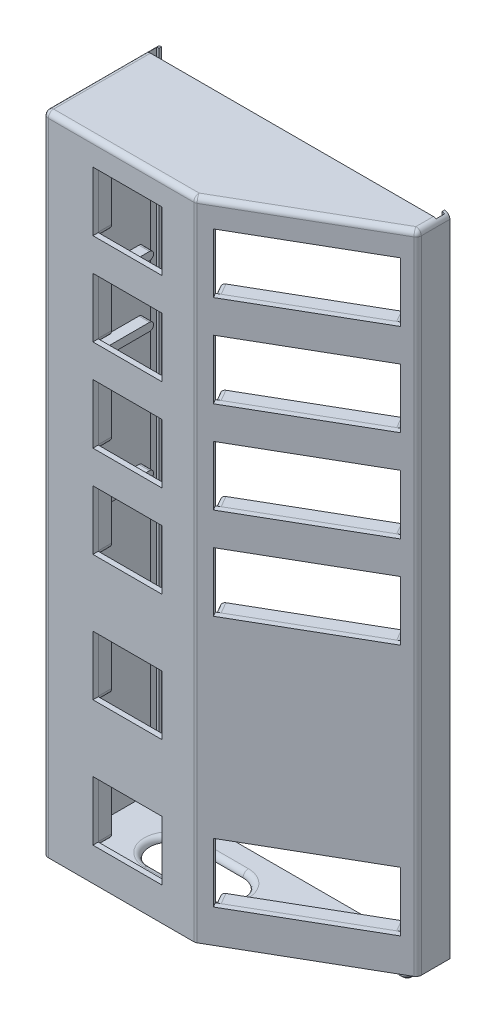
from build123d import *

# Parameters (mm, degrees)
MAIN_BODY_DEPTH           = 241.93
SHELL1_T                  = -2
SINGLE_CUTOUTS_DEPTH      = 252.708123436
SINGLE_CUTOUTS_DEPTH_BACK = 252.708123436
SKETCH3_W                 = 25.87
SKETCH3_H                 = 22.27
DOUBLE_CUTOUTS_DEPTH      = 254.30100721
DOUBLE_CUTOUTS_DEPTH_BACK = 254.30100721
SKETCH4_W                 = 51.25
SKETCH4_H                 = 22.27
SKETCH5_R                 = 2.75
MATING_STUDS_DEPTH        = 5
MATING_STUD_CHAMFER_SIZE  = 1
PASS_THRU_REACH           = 251.009
PCB_MOUNTS_SINGLE_DEPTH   = 5
PCB_MOUNTS_DOUBLE_DEPTH   = 5
PCB_MOUNTS_SIDES_DEPTH    = 4
FILLET1_R                 = 2
BACK_PANEL_CUT_DEPTH      = 254.869825946
BACK_PANEL_CUT_DEPTH_BACK = 254.869825946
FILLET2_R                 = 2


with BuildPart() as part:
    # Sketch2 → Main Body (new body)
    with BuildSketch(Plane(origin=(0, 0, 0), x_dir=(1, 0, 0), z_dir=(0, 1, 0))):
        Polygon((-55, -21.22412839), (-55, 21.22412839), (55, 21.22412839), (55, 9.359414853), (2.027749229, -21.22412839), align=None)
    extrude(amount=MAIN_BODY_DEPTH)

    # Shell1
    shell1_openings = [part.faces().sort_by_distance(p)[0] for p in [
        (0, 120.965, -21.22412839),
    ]]
    offset(amount=SHELL1_T, openings=shell1_openings, kind=Kind.INTERSECTION)

    # Sketch3 → Single Cutouts (cut, two sides: drawn at the far end of the back side and taken through both)
    with BuildSketch(Plane.XY.offset(21.22412839).offset(-SINGLE_CUTOUTS_DEPTH_BACK)):
        with Locations((-23.357250771, 23.585)):
            Rectangle(SKETCH3_W, SKETCH3_H)
        with Locations((-23.357250771, 70.755)):
            Rectangle(SKETCH3_W, SKETCH3_H)
        with Locations((-23.357250771, 117.925)):
            Rectangle(SKETCH3_W, SKETCH3_H)
        with Locations((-23.357250771, 152.395)):
            Rectangle(SKETCH3_W, SKETCH3_H)
        with Locations((-23.357250771, 186.865)):
            Rectangle(SKETCH3_W, SKETCH3_H)
        with Locations((-23.357250771, 221.335)):
            Rectangle(SKETCH3_W, SKETCH3_H)
    extrude(amount=SINGLE_CUTOUTS_DEPTH + SINGLE_CUTOUTS_DEPTH_BACK, mode=Mode.SUBTRACT)

    # Sketch4 → Double Cutouts (cut, two sides: drawn at the far end of the back side and taken through both)
    with BuildSketch(Plane(origin=(9.697254487, 0, 16.796137465), x_dir=(0.8660254037844449, 0, -0.4999999999999892), z_dir=(0.4999999999999891, 0, 0.8660254037844448)).offset(-DOUBLE_CUTOUTS_DEPTH_BACK)):
        with Locations((21.76901815, 221.335)):
            Rectangle(SKETCH4_W, SKETCH4_H)
        with Locations((21.76901815, 186.865)):
            Rectangle(SKETCH4_W, SKETCH4_H)
        with Locations((21.76901815, 152.395)):
            Rectangle(SKETCH4_W, SKETCH4_H)
        with Locations((21.76901815, 117.925)):
            Rectangle(SKETCH4_W, SKETCH4_H)
        with Locations((21.76901815, 23.585)):
            Rectangle(SKETCH4_W, SKETCH4_H)
    extrude(amount=DOUBLE_CUTOUTS_DEPTH + DOUBLE_CUTOUTS_DEPTH_BACK, mode=Mode.SUBTRACT)

    # Sketch5 → Mating Studs (add)
    with BuildSketch(Plane.XZ):
        with Locations(Location((47, -13.22412839, 0), (0, 0, 270))):
            Circle(SKETCH5_R)
        with Locations(Location((-47, 13.22412839, 0), (0, 0, 270))):
            Circle(SKETCH5_R)
        with Locations(Location((-47, -13.22412839, 0), (0, 0, 270))):
            Circle(SKETCH5_R)
        with Locations(Location((-2, 13.22412839, 0), (0, 0, 270))):
            Circle(SKETCH5_R)
    extrude(amount=MATING_STUDS_DEPTH)

    # Mating Stud Chamfer
    mating_stud_chamfer_edges = [part.edges().sort_by_distance(p)[0] for p in [
        (47, -5, -10.47412839),
        (-47, -5, 15.97412839),
        (-47, -5, -10.47412839),
        (-2, -5, 15.97412839),
    ]]
    chamfer(mating_stud_chamfer_edges, length=MATING_STUD_CHAMFER_SIZE)

    # Sketch6 → Pass Thru (cut, up to next)
    with BuildSketch(Plane.XZ, mode=Mode.PRIVATE) as pass_thru_sk1:
        with BuildLine():
            Line((-30, 6.27587161), (-10, 6.27587161))
            ThreePointArc((-10, 6.27587161), (-2.5, -1.22412839), (-10, -8.72412839))
            Line((-10, -8.72412839), (-30, -8.72412839))
            ThreePointArc((-30, -8.72412839), (-37.5, -1.22412839), (-30, 6.27587161))
        make_face()
    pass_thru_tool1 = extrude(pass_thru_sk1.sketch, amount=-PASS_THRU_REACH, mode=Mode.PRIVATE) & part.part
    add(pass_thru_tool1.solids().sort_by_distance((-20, 0, -1.224128))[0], mode=Mode.SUBTRACT)

    # Sketch7 → PCB Mounts  - Single (add)
    with BuildSketch(Plane(origin=(0, 0, 19.22412839), x_dir=(-1, 0, 0), z_dir=(0, 0, -1))):
        with BuildLine():
            Line((6.407250771, 12.585), (6.407250771, 34.585))
            ThreePointArc((6.407250771, 34.585), (8.407250771, 36.585), (10.407250771, 34.585))
            Line((10.407250771, 34.585), (10.407250771, 12.585))
            ThreePointArc((10.407250771, 12.585), (8.407250771, 10.585), (6.407250771, 12.585))
        make_face()
        with BuildLine():
            Line((6.407250771, 59.755), (6.407250771, 81.755))
            ThreePointArc((6.407250771, 81.755), (8.407250771, 83.755), (10.407250771, 81.755))
            Line((10.407250771, 81.755), (10.407250771, 59.755))
            ThreePointArc((10.407250771, 59.755), (8.407250771, 57.755), (6.407250771, 59.755))
        make_face()
        with BuildLine():
            Line((6.407250771, 106.925), (6.407250771, 128.925))
            ThreePointArc((6.407250771, 128.925), (8.407250771, 130.925), (10.407250771, 128.925))
            Line((10.407250771, 128.925), (10.407250771, 106.925))
            ThreePointArc((10.407250771, 106.925), (8.407250771, 104.925), (6.407250771, 106.925))
        make_face()
        with BuildLine():
            Line((6.407250771, 141.395), (6.407250771, 163.395))
            ThreePointArc((6.407250771, 163.395), (8.407250771, 165.395), (10.407250771, 163.395))
            Line((10.407250771, 163.395), (10.407250771, 141.395))
            ThreePointArc((10.407250771, 141.395), (8.407250771, 139.395), (6.407250771, 141.395))
        make_face()
        with BuildLine():
            Line((10.407250771, 232.335), (10.407250771, 210.335))
            ThreePointArc((10.407250771, 210.335), (8.407250771, 208.335), (6.407250771, 210.335))
            Line((6.407250771, 210.335), (6.407250771, 232.335))
            ThreePointArc((6.407250771, 232.335), (8.407250771, 234.335), (10.407250771, 232.335))
        make_face()
        with BuildLine():
            Line((10.407250771, 197.865), (10.407250771, 175.865))
            ThreePointArc((10.407250771, 175.865), (8.407250771, 173.865), (6.407250771, 175.865))
            Line((6.407250771, 175.865), (6.407250771, 197.865))
            ThreePointArc((6.407250771, 197.865), (8.407250771, 199.865), (10.407250771, 197.865))
        make_face()
        with BuildLine():
            Line((40.307250771, 12.585), (40.307250771, 34.585))
            ThreePointArc((40.307250771, 34.585), (38.307250771, 36.585), (36.307250771, 34.585))
            Line((36.307250771, 34.585), (36.307250771, 12.585))
            ThreePointArc((36.307250771, 12.585), (38.307250771, 10.585), (40.307250771, 12.585))
        make_face()
        with BuildLine():
            Line((40.307250771, 59.755), (40.307250771, 81.755))
            ThreePointArc((40.307250771, 81.755), (38.307250771, 83.755), (36.307250771, 81.755))
            Line((36.307250771, 81.755), (36.307250771, 59.755))
            ThreePointArc((36.307250771, 59.755), (38.307250771, 57.755), (40.307250771, 59.755))
        make_face()
        with BuildLine():
            Line((40.307250771, 106.925), (40.307250771, 128.925))
            ThreePointArc((40.307250771, 128.925), (38.307250771, 130.925), (36.307250771, 128.925))
            Line((36.307250771, 128.925), (36.307250771, 106.925))
            ThreePointArc((36.307250771, 106.925), (38.307250771, 104.925), (40.307250771, 106.925))
        make_face()
        with BuildLine():
            Line((40.307250771, 141.395), (40.307250771, 163.395))
            ThreePointArc((40.307250771, 163.395), (38.307250771, 165.395), (36.307250771, 163.395))
            Line((36.307250771, 163.395), (36.307250771, 141.395))
            ThreePointArc((36.307250771, 141.395), (38.307250771, 139.395), (40.307250771, 141.395))
        make_face()
        with BuildLine():
            Line((36.307250771, 232.335), (36.307250771, 210.335))
            ThreePointArc((36.307250771, 210.335), (38.307250771, 208.335), (40.307250771, 210.335))
            Line((40.307250771, 210.335), (40.307250771, 232.335))
            ThreePointArc((40.307250771, 232.335), (38.307250771, 234.335), (36.307250771, 232.335))
        make_face()
        with BuildLine():
            Line((36.307250771, 197.865), (36.307250771, 175.865))
            ThreePointArc((36.307250771, 175.865), (38.307250771, 173.865), (40.307250771, 175.865))
            Line((40.307250771, 175.865), (40.307250771, 197.865))
            ThreePointArc((40.307250771, 197.865), (38.307250771, 199.865), (36.307250771, 197.865))
        make_face()
    extrude(amount=PCB_MOUNTS_SINGLE_DEPTH)

    # Sketch9 → PCB Mounts - Double (add)
    with BuildSketch(Plane(origin=(8.697254487, 0, 15.064086657), x_dir=(-0.8660254037844414, 0, 0.49999999999999517), z_dir=(-0.49999999999999517, 0, -0.8660254037844414))):
        with BuildLine():
            Line((-45.84401815, 235.57), (2.30598185, 235.57))
            ThreePointArc((2.30598185, 235.57), (3.80598185, 234.07), (2.30598185, 232.57))
            Line((2.30598185, 232.57), (-45.84401815, 232.57))
            ThreePointArc((-45.84401815, 232.57), (-47.34401815, 234.07), (-45.84401815, 235.57))
        make_face()
        with BuildLine():
            Line((-45.84401815, 210.1), (2.30598185, 210.1))
            ThreePointArc((2.30598185, 210.1), (3.80598185, 208.6), (2.30598185, 207.1))
            Line((2.30598185, 207.1), (-45.84401815, 207.1))
            ThreePointArc((-45.84401815, 207.1), (-47.34401815, 208.6), (-45.84401815, 210.1))
        make_face()
        with BuildLine():
            Line((-45.84401815, 201.1), (2.30598185, 201.1))
            ThreePointArc((2.30598185, 201.1), (3.80598185, 199.6), (2.30598185, 198.1))
            Line((2.30598185, 198.1), (-45.84401815, 198.1))
            ThreePointArc((-45.84401815, 198.1), (-47.34401815, 199.6), (-45.84401815, 201.1))
        make_face()
        with BuildLine():
            Line((-45.84401815, 175.63), (2.30598185, 175.63))
            ThreePointArc((2.30598185, 175.63), (3.80598185, 174.13), (2.30598185, 172.63))
            Line((2.30598185, 172.63), (-45.84401815, 172.63))
            ThreePointArc((-45.84401815, 172.63), (-47.34401815, 174.13), (-45.84401815, 175.63))
        make_face()
        with BuildLine():
            Line((-45.84401815, 166.63), (2.30598185, 166.63))
            ThreePointArc((2.30598185, 166.63), (3.80598185, 165.13), (2.30598185, 163.63))
            Line((2.30598185, 163.63), (-45.84401815, 163.63))
            ThreePointArc((-45.84401815, 163.63), (-47.34401815, 165.13), (-45.84401815, 166.63))
        make_face()
        with BuildLine():
            Line((-45.84401815, 141.16), (2.30598185, 141.16))
            ThreePointArc((2.30598185, 141.16), (3.80598185, 139.66), (2.30598185, 138.16))
            Line((2.30598185, 138.16), (-45.84401815, 138.16))
            ThreePointArc((-45.84401815, 138.16), (-47.34401815, 139.66), (-45.84401815, 141.16))
        make_face()
        with BuildLine():
            Line((-45.84401815, 132.16), (2.30598185, 132.16))
            ThreePointArc((2.30598185, 132.16), (3.80598185, 130.66), (2.30598185, 129.16))
            Line((2.30598185, 129.16), (-45.84401815, 129.16))
            ThreePointArc((-45.84401815, 129.16), (-47.34401815, 130.66), (-45.84401815, 132.16))
        make_face()
        with BuildLine():
            Line((-45.84401815, 106.69), (2.30598185, 106.69))
            ThreePointArc((2.30598185, 106.69), (3.80598185, 105.19), (2.30598185, 103.69))
            Line((2.30598185, 103.69), (-45.84401815, 103.69))
            ThreePointArc((-45.84401815, 103.69), (-47.34401815, 105.19), (-45.84401815, 106.69))
        make_face()
        with BuildLine():
            Line((-45.84401815, 37.82), (2.30598185, 37.82))
            ThreePointArc((2.30598185, 37.82), (3.80598185, 36.32), (2.30598185, 34.82))
            Line((2.30598185, 34.82), (-45.84401815, 34.82))
            ThreePointArc((-45.84401815, 34.82), (-47.34401815, 36.32), (-45.84401815, 37.82))
        make_face()
        with BuildLine():
            Line((-45.84401815, 12.35), (2.30598185, 12.35))
            ThreePointArc((2.30598185, 12.35), (3.80598185, 10.85), (2.30598185, 9.35))
            Line((2.30598185, 9.35), (-45.84401815, 9.35))
            ThreePointArc((-45.84401815, 9.35), (-47.34401815, 10.85), (-45.84401815, 12.35))
        make_face()
    extrude(amount=PCB_MOUNTS_DOUBLE_DEPTH)

    # Sketch11 → PCB Mounts - Sides (add)
    with BuildSketch(Plane(origin=(-53, 0, 0), x_dir=(0, 0, -1), z_dir=(1, 0, 0))):
        with BuildLine():
            Line((-12.27587161, 229.93), (12.72412839, 229.93))
            ThreePointArc((12.72412839, 229.93), (14.22412839, 228.43), (12.72412839, 226.93))
            Line((12.72412839, 226.93), (-12.27587161, 226.93))
            ThreePointArc((-12.27587161, 226.93), (-13.77587161, 228.43), (-12.27587161, 229.93))
        make_face()
        with BuildLine():
            Line((-12.27587161, 181.78), (12.72412839, 181.78))
            ThreePointArc((12.72412839, 181.78), (14.22412839, 180.28), (12.72412839, 178.78))
            Line((12.72412839, 178.78), (-12.27587161, 178.78))
            ThreePointArc((-12.27587161, 178.78), (-13.77587161, 180.28), (-12.27587161, 181.78))
        make_face()
        with BuildLine():
            Line((-12.27587161, 158.78), (12.72412839, 158.78))
            ThreePointArc((12.72412839, 158.78), (14.22412839, 157.28), (12.72412839, 155.78))
            Line((12.72412839, 155.78), (-12.27587161, 155.78))
            ThreePointArc((-12.27587161, 155.78), (-13.77587161, 157.28), (-12.27587161, 158.78))
        make_face()
        with BuildLine():
            Line((-12.27587161, 110.63), (12.72412839, 110.63))
            ThreePointArc((12.72412839, 110.63), (14.22412839, 109.13), (12.72412839, 107.63))
            Line((12.72412839, 107.63), (-12.27587161, 107.63))
            ThreePointArc((-12.27587161, 107.63), (-13.77587161, 109.13), (-12.27587161, 110.63))
        make_face()
        with BuildLine():
            Line((-12.27587161, 72.63), (12.72412839, 72.63))
            ThreePointArc((12.72412839, 72.63), (14.22412839, 71.13), (12.72412839, 69.63))
            Line((12.72412839, 69.63), (-12.27587161, 69.63))
            ThreePointArc((-12.27587161, 69.63), (-13.77587161, 71.13), (-12.27587161, 72.63))
        make_face()
        with BuildLine():
            Line((-12.27587161, 24.48), (12.72412839, 24.48))
            ThreePointArc((12.72412839, 24.48), (14.22412839, 22.98), (12.72412839, 21.48))
            Line((12.72412839, 21.48), (-12.27587161, 21.48))
            ThreePointArc((-12.27587161, 21.48), (-13.77587161, 22.98), (-12.27587161, 24.48))
        make_face()
    extrude(amount=PCB_MOUNTS_SIDES_DEPTH)

    # Fillet1
    fillet1_edges = [part.edges().sort_by_distance(p)[0] for p in [
        (55, 241.93, -15.291771621),
        (-55, 241.93, 0),
        (-26.486125385, 241.93, 21.22412839),
        (28.513874615, 241.93, 5.932356769),
        (-55, 120.965, 21.22412839),
        (55, 120.965, -9.359414853),
        (2.027749229, 120.965, 21.22412839),
    ]]
    fillet(fillet1_edges, radius=FILLET1_R)

    # Sketch13 → Back Panel Cut (cut, two sides: drawn at the far end of the back side and taken through both)
    with BuildSketch(Plane(origin=(0, 241.93, 0), x_dir=(1, 0, 0), z_dir=(0, 1, 0)).offset(-BACK_PANEL_CUT_DEPTH_BACK)):
        Polygon((-54, 20.22412839), (-53, 20.22412839), (-53, 21.22412839), (53, 21.22412839), (53, 20.22412839), (54, 20.22412839), (54, 17.04912839), (-54, 17.04912839), align=None)
    extrude(amount=BACK_PANEL_CUT_DEPTH + BACK_PANEL_CUT_DEPTH_BACK, mode=Mode.SUBTRACT)

    # Fillet2
    fillet2_edges = [part.edges().sort_by_distance(p)[0] for p in [
        (-20, 2, 6.27587161),
        (-37.5, 2, -1.22412839),
        (-20, 2, -8.72412839),
        (-2.5, 2, -1.22412839),
    ]]
    fillet(fillet2_edges, radius=FILLET2_R - 0.0001)  # a hair under: the kernel refuses the full size


solid = part.part
